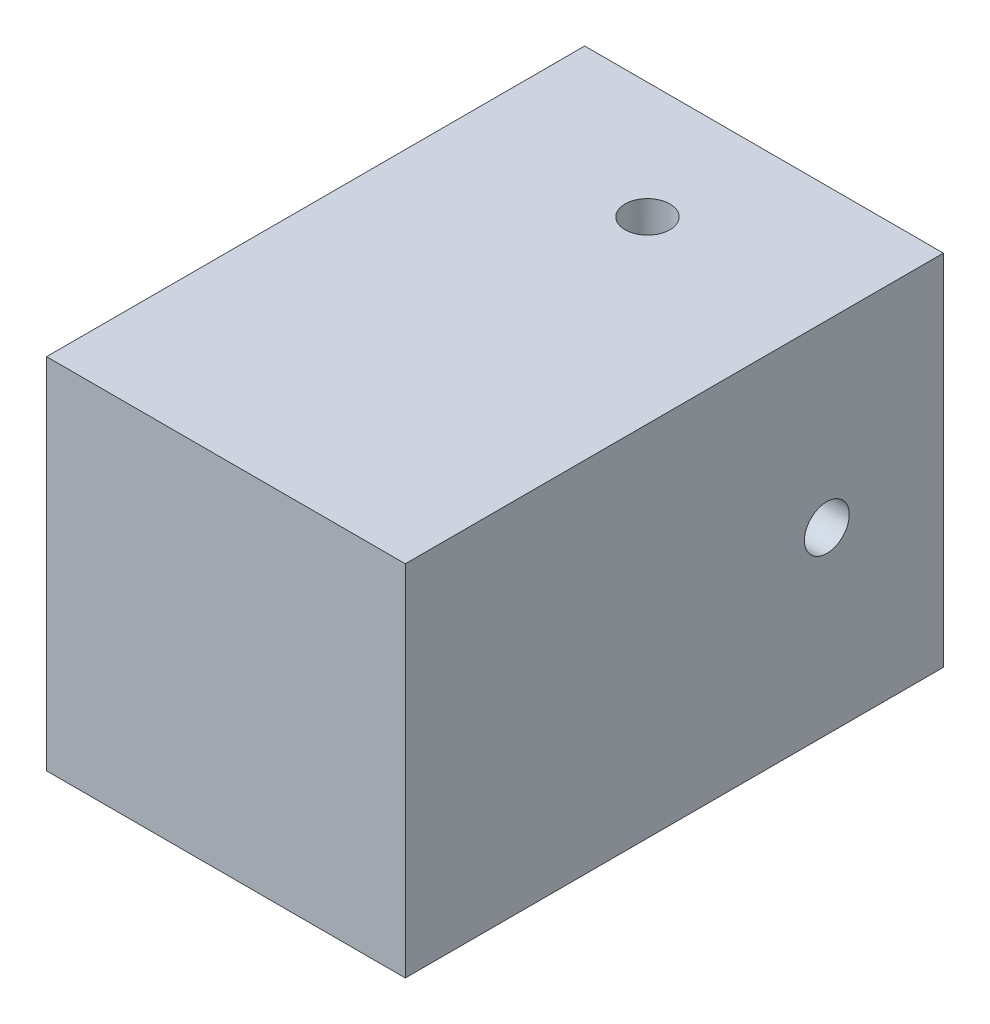
from build123d import *

# Parameters (mm, degrees)
SKETCH_1_W          = 40
SKETCH_1_H          = 40
EXTRUDE_1_DEPTH     = 60
SKETCH_7_R          = 2.5
CUT_EXTRUDE_1_DEPTH = 10
SKETCH_8_R          = 2.5
CUT_EXTRUDE_2_DEPTH = 10
SKETCH_10_W         = 30
SKETCH_10_H         = 30
CUT_EXTRUDE_3_DEPTH = 50


with BuildPart() as part:
    # 草图1 → 凸台-拉伸1 (new body)
    with BuildSketch(Plane.XY):
        Rectangle(SKETCH_1_W, SKETCH_1_H)
    extrude(amount=EXTRUDE_1_DEPTH)

    # 草图7 → 切除-拉伸1 (cut)
    with BuildSketch(Plane.XZ.offset(20)):
        with Locations((0, 13)):
            Circle(SKETCH_7_R)
    cut_extrude_1 = extrude(amount=-CUT_EXTRUDE_1_DEPTH, mode=Mode.SUBTRACT)

    # 草图8 → 切除-拉伸2 (cut)
    with BuildSketch(Plane(origin=(20, 0, 0), x_dir=(0, 0, -1), z_dir=(1, 0, 0))):
        with Locations((-13, 0)):
            Circle(SKETCH_8_R)
    cut_extrude_2 = extrude(amount=-CUT_EXTRUDE_2_DEPTH, mode=Mode.SUBTRACT)

    # 镜向1: 切除-拉伸1 across plane
    add(cut_extrude_1.mirror(Plane.ZX), mode=Mode.SUBTRACT)

    # 镜向2: 切除-拉伸2 across plane
    add(cut_extrude_2.mirror(Plane(origin=(0, 0, 0), x_dir=(0, 0, 1), z_dir=(1, 0, 0))), mode=Mode.SUBTRACT)

    # 草图10 → 切除-拉伸3 (cut)
    with BuildSketch(Plane(origin=(0, 0, 0), x_dir=(-1, 0, 0), z_dir=(0, 0, -1))):
        Rectangle(SKETCH_10_W, SKETCH_10_H)
    extrude(amount=-CUT_EXTRUDE_3_DEPTH, mode=Mode.SUBTRACT)


solid = part.part
